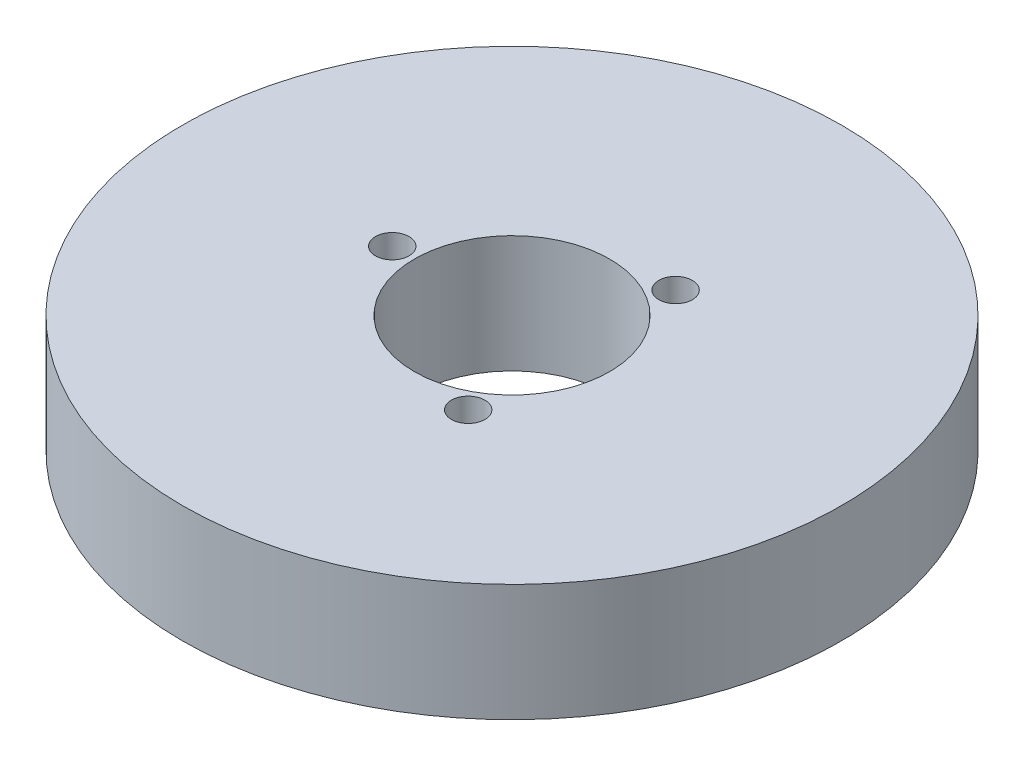
from build123d import *

# Parameters (mm, degrees)
SKETCH1_R           = 67.5
BOSS_EXTRUDE1_DEPTH = 24
SKETCH2_R           = 20
CUT_EXTRUDE1_DEPTH  = 99.430178299
SKETCH3_R           = 3.434805269
CUT_EXTRUDE2_DEPTH  = 18.982193421
CIRPATTERN1_COUNT   = 3


with BuildPart() as part:
    # Sketch1 → Boss-Extrude1 (new body)
    with BuildSketch(Plane(origin=(0, 0, 0), x_dir=(1, 0, 0), z_dir=(0, 1, 0))):
        Circle(SKETCH1_R)
    extrude(amount=BOSS_EXTRUDE1_DEPTH)

    # Sketch2 → Cut-Extrude1 (cut, through all)
    with BuildSketch(Plane(origin=(0, 0, 0), x_dir=(1, 0, 0), z_dir=(0, 1, 0))):
        Circle(SKETCH2_R)
    extrude(amount=CUT_EXTRUDE1_DEPTH, mode=Mode.SUBTRACT)

    # Sketch3 → Cut-Extrude2 (cut)
    with BuildSketch(Plane(origin=(0, 24, 0), x_dir=(1, 0, 0), z_dir=(0, 1, 0))):
        with Locations((-24.528298912, 0)):
            Circle(SKETCH3_R)
    cut_extrude2 = extrude(amount=-CUT_EXTRUDE2_DEPTH, mode=Mode.SUBTRACT)

    # CirPattern1: Cut-Extrude2 ×3 about axis
    cirpattern1_axis = Axis((0, 0, 0), (0, 1, 0))
    for i in range(1, CIRPATTERN1_COUNT):
        add(cut_extrude2.rotate(cirpattern1_axis, i * 360 / CIRPATTERN1_COUNT), mode=Mode.SUBTRACT)


solid = part.part
